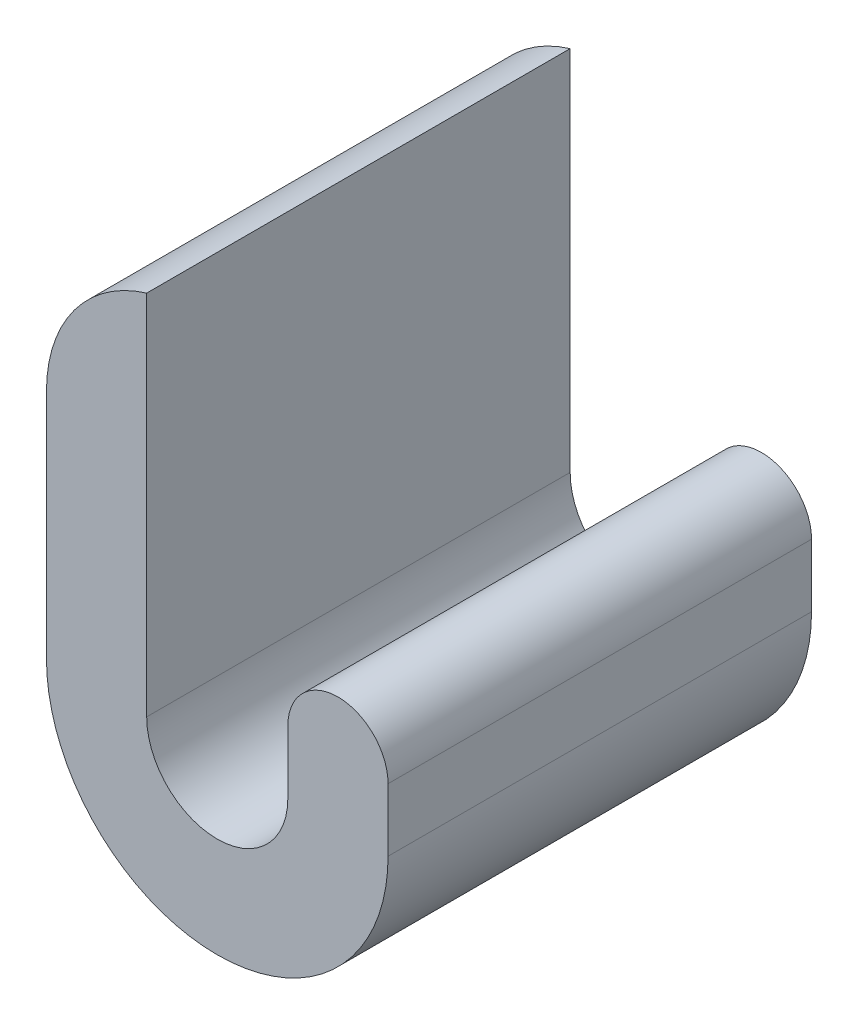
from build123d import *

# Parameters (mm, degrees)
BOSS_EXTRUDE1_DEPTH = 30
FILLET1_R           = 10
FILLET3_RADIUS      = 3.55
FILLET3_LENGTH      = 30


with BuildPart() as part:
    # Sketch1 → Boss-Extrude1 (new body)
    with BuildSketch(Plane.XY):
        with BuildLine():
            Line((5, 0), (5, 8))
            Line((5, 8), (12.1, 8))
            Line((12.1, 8), (12.1, 0))
            ThreePointArc((12.1, 0), (0, -12.1), (-12.1, 0))
            Line((-12.1, 0), (-12.1, 26))
            Line((-12.1, 26), (-5, 26))
            Line((-5, 26), (-5, 0))
            ThreePointArc((-5, 0), (0, -5), (5, 0))
        make_face()
    extrude(amount=-BOSS_EXTRUDE1_DEPTH)

    # Fillet1
    # the kernel refuses this fillet: 10 mm, written as the material it takes off along each edge
    with BuildSketch(Plane(origin=(-12.1, 26, 23.925666135), x_dir=(0, -1, 0), z_dir=(0, 0, -1))) as fillet1_piece_1:
        with BuildLine():
            CenterArc((9.570266454, -10), FILLET1_R, 90, 73.142043978)
            Line((0, -7.1), (-0.191405329, -7.042))
            ThreePointArc((-0.191405329, -7.042), (-0.2, -3.55), (-0.2, 0))
            Line((-0.2, 0), (0, 0.2))
            Line((0, 0.2), (9.570266454, 0.2))
            Line((9.570266454, 0.2), (9.570266454, 0))
        make_face()
    extrude(amount=77.85133227, mode=Mode.SUBTRACT)

    # Fillet3: full round fillet: the end face becomes a half cylinder, R = half its width
    fillet3_face = Plane((8.55, 8, -15), x_dir=(0, 0, 1), z_dir=(0, 1, 0))  # on the end face: x along it, z out of the body
    fillet3_slab = fillet3_face.offset(-FILLET3_RADIUS / 2) * Box(FILLET3_LENGTH, 2 * FILLET3_RADIUS, FILLET3_RADIUS, mode=Mode.PRIVATE)  # the body's end, R deep
    fillet3_round = Plane((8.55, 4.45, -15), x_dir=(0, 1, 0), z_dir=(0, 0, 1)) * Cylinder(FILLET3_RADIUS, FILLET3_LENGTH, mode=Mode.PRIVATE)  # its axis R under the face
    add(fillet3_slab - fillet3_round, mode=Mode.SUBTRACT)


solid = part.part
